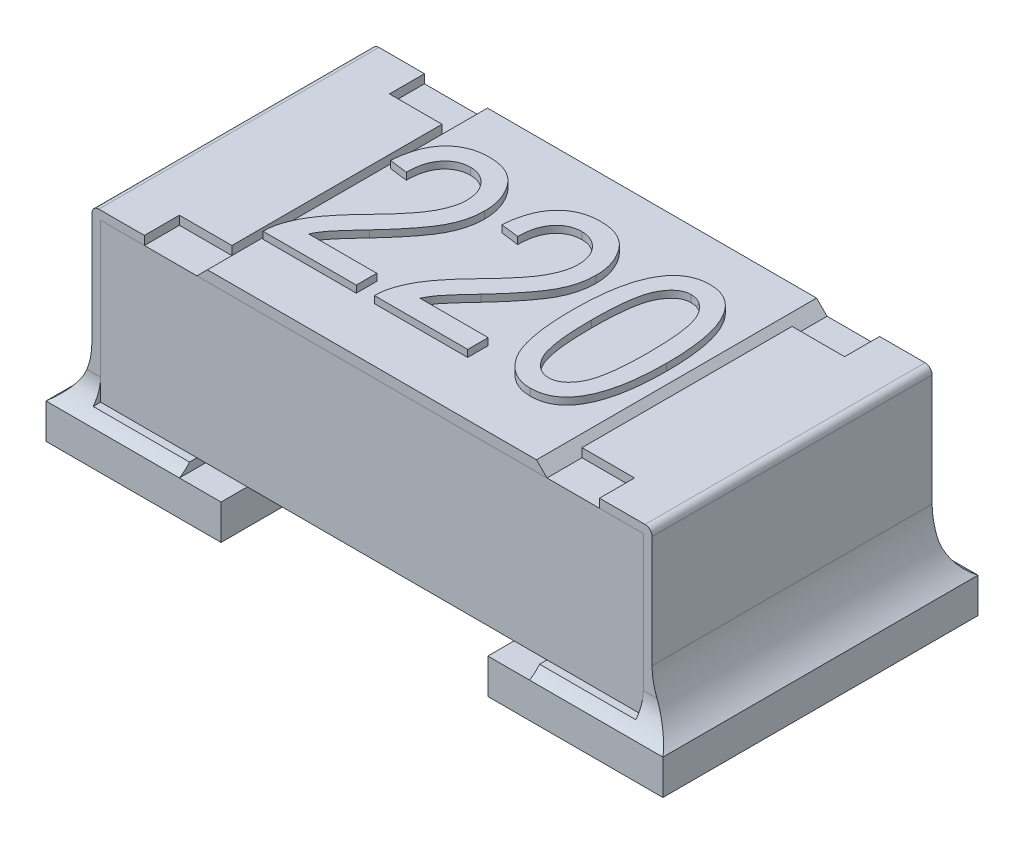
from build123d import *

# Parameters (mm, degrees)
SKETCH1_W             = 0.8
SKETCH1_H             = 0.45
BOSS_EXTRUDE1_DEPTH   = 0.775
BOSS_EXTRUDE2_DEPTH   = 0.4
BOSS_EXTRUDE2_2_DEPTH = 0.4
SKETCH3_W             = 0.15
SKETCH3_H             = 0.1
CUT_EXTRUDE1_DEPTH    = 0.025
BOSS_EXTRUDE3_DEPTH   = 0.4
SKETCH7_W             = 0.5
SKETCH7_H             = 0.9
BOSS_EXTRUDE5_DEPTH   = 0.1
FILLET3_R             = 0.2
FILLET4_R             = 0.2
FILLET5_R             = 0.1
FILLET6_R             = 0.1
BOSS_EXTRU_1_DEPTH    = 0.02


with BuildPart() as part:
    # Sketch1 → Boss-Extrude1 (new, symmetric)
    with BuildSketch(Plane(origin=(0, 0, 0), x_dir=(0, 0, -1), z_dir=(1, 0, 0))):
        with Locations((0, 0.35)):
            Rectangle(SKETCH1_W, SKETCH1_H)
    extrude(amount=BOSS_EXTRUDE1_DEPTH, both=True)


with BuildPart() as body_2:
    # Sketch2 → Boss-Extrude2 (new, symmetric)
    with BuildSketch(Plane.XY):
        with BuildLine():
            Line((-0.5, 0.6), (-0.78, 0.6))
            ThreePointArc((-0.78, 0.6), (-0.794142136, 0.594142136), (-0.8, 0.58))
            Line((-0.8, 0.58), (-0.8, 0.1))
            Line((-0.8, 0.1), (-0.5, 0.1))
            Line((-0.5, 0.1), (-0.5, 0.125))
            Line((-0.5, 0.125), (-0.775, 0.125))
            Line((-0.775, 0.125), (-0.775, 0.575))
            Line((-0.775, 0.575), (-0.5, 0.575))
            Line((-0.5, 0.575), (-0.5, 0.6))
        make_face()
    extrude(amount=BOSS_EXTRUDE2_DEPTH, both=True)


with BuildPart() as body_3:
    # Sketch2 → Boss-Extrude2 2 (new, symmetric)
    with BuildSketch(Plane.XY):
        with BuildLine():
            Line((0.5, 0.575), (0.5, 0.6))
            Line((0.5, 0.6), (0.78, 0.6))
            ThreePointArc((0.78, 0.6), (0.794142136, 0.594142136), (0.8, 0.58))
            Line((0.8, 0.58), (0.8, 0.1))
            Line((0.8, 0.1), (0.5, 0.1))
            Line((0.5, 0.1), (0.5, 0.125))
            Line((0.5, 0.125), (0.775, 0.125))
            Line((0.775, 0.125), (0.775, 0.575))
            Line((0.775, 0.575), (0.5, 0.575))
        make_face()
    extrude(amount=BOSS_EXTRUDE2_2_DEPTH, both=True)


with BuildPart() as cut_extrude1_tool:
    # Sketch3 → Cut-Extrude1 (new body)
    with BuildSketch(Plane(origin=(0, 0.6, 0), x_dir=(1, 0, 0), z_dir=(0, 1, 0))):
        with Locations((-0.575, 0.35)):
            Rectangle(SKETCH3_W, SKETCH3_H)
        with Locations((-0.575, -0.35)):
            Rectangle(SKETCH3_W, SKETCH3_H)
        with Locations((0.575, -0.35)):
            Rectangle(SKETCH3_W, SKETCH3_H)
        with Locations((0.575, 0.35)):
            Rectangle(SKETCH3_W, SKETCH3_H)
    extrude(amount=-CUT_EXTRUDE1_DEPTH)


with BuildPart() as body_2_1:
    add(body_2.part)

    # Cut-Extrude1: cut by cut_extrude1_tool
    add(cut_extrude1_tool.part, mode=Mode.SUBTRACT)



with BuildPart() as body_3_1:
    add(body_3.part)

    # Cut-Extrude1: cut by cut_extrude1_tool
    add(cut_extrude1_tool.part, mode=Mode.SUBTRACT)


with BuildPart() as body_4:
    # Sketch4 → Boss-Extrude3 (new, symmetric)
    with BuildSketch(Plane.XY):
        Polygon((-0.5, 0.575), (0.5, 0.575), (0.47, 0.605), (-0.47, 0.605), align=None)
    extrude(amount=BOSS_EXTRUDE3_DEPTH, both=True)

    # Esquisse2 → Boss.-Extru.1 (add)
    # profile 1 of 3: a face of its own
    with BuildSketch(Plane(origin=(0, 0.605, 0), x_dir=(1, 0, 0), z_dir=(0, 1, 0))):
        with BuildLine():
            Line((-0.199497081, -0.186780329), (-0.199497081, -0.245221888))
            Line((-0.199497081, -0.245221888), (-0.465730847, -0.245221888))
            add(Edge.make_bspline(
                [(-0.465730847, -0.245221888), (-0.465743174, -0.242176838), (-0.465768148, -0.236007517), (-0.464937832, -0.226601844), (-0.463231876, -0.216968453), (-0.461053544, -0.206978835), (-0.457964907, -0.196764374), (-0.454183842, -0.186275439), (-0.449722518, -0.175538143), (-0.444498715, -0.164488895), (-0.438394438, -0.153021711), (-0.431028345, -0.141184566), (-0.422562877, -0.128765128), (-0.412986839, -0.115839112), (-0.402112947, -0.102529104), (-0.390263949, -0.088637518), (-0.377270744, -0.074193289), (-0.368019554, -0.064593521), (-0.363255198, -0.059649647)],
                knots=[0, 0, 0, 0, 0.672188691, 1.361865275, 2.08134618, 2.831455259, 3.618325166, 4.435686407, 5.292818481, 6.184803937, 7.133719261, 8.159707436, 9.261705982, 10.452168352, 11.710682541, 13.056179633, 14.483934645, 16, 16, 16, 16], degree=3))
            add(Edge.make_bspline(
                [(-0.363255198, -0.059649647), (-0.357718482, -0.053922862), (-0.347057966, -0.042896383), (-0.332054308, -0.026615111), (-0.318421978, -0.011481871), (-0.306433341, 0.002776991), (-0.295875555, 0.015967273), (-0.286642397, 0.028070116), (-0.279175119, 0.039360185), (-0.271112582, 0.052644574), (-0.263426099, 0.068459429), (-0.256630812, 0.086894144), (-0.252240187, 0.104715028), (-0.251704992, 0.116463957), (-0.251445133, 0.122168535)],
                knots=[0, 0, 0, 0, 1.312560889, 2.527233899, 3.64818266, 4.668586789, 5.596397896, 6.432357998, 7.175835261, 7.825761013, 8.992224112, 10.065918602, 11.060925749, 12, 12, 12, 12], degree=3))
            add(Edge.make_bspline(
                [(-0.251445133, 0.122168535), (-0.251481367, 0.125317915), (-0.251552135, 0.131468985), (-0.252754744, 0.140451965), (-0.254469824, 0.14899617), (-0.256734237, 0.157163351), (-0.259944913, 0.164819361), (-0.263791845, 0.172017316), (-0.26829798, 0.178789817), (-0.273440164, 0.185037408), (-0.279110823, 0.190673516), (-0.285086903, 0.195736851), (-0.291523865, 0.199834879), (-0.298157149, 0.203402296), (-0.305210907, 0.205987741), (-0.312536604, 0.207958519), (-0.320202019, 0.209069733), (-0.325406889, 0.209238117), (-0.328048217, 0.209323567)],
                knots=[0, 0, 0, 0, 1.164486654, 2.274364258, 3.346924328, 4.388668322, 5.404300818, 6.412115579, 7.404820287, 8.409522099, 9.400647826, 10.360464378, 11.301161788, 12.219192522, 13.141987859, 14.073903283, 15.022558797, 16, 16, 16, 16], degree=3))
            add(Edge.make_bspline(
                [(-0.328048217, 0.209323567), (-0.330896087, 0.209263822), (-0.336455261, 0.209147197), (-0.344558118, 0.207697867), (-0.352322144, 0.205758951), (-0.35970794, 0.202751859), (-0.366661483, 0.198899959), (-0.373282941, 0.194263463), (-0.379442709, 0.188754733), (-0.385264869, 0.182490648), (-0.390368734, 0.175347606), (-0.395054831, 0.167618053), (-0.398744935, 0.158974566), (-0.401882588, 0.149683668), (-0.404339864, 0.139637057), (-0.405982357, 0.128872622), (-0.407186878, 0.117392989), (-0.407254524, 0.109489326), (-0.407289289, 0.105427463)],
                knots=[0, 0, 0, 0, 0.928788257, 1.813037313, 2.680996359, 3.53827917, 4.408273621, 5.272359245, 6.172129225, 7.102295458, 8.058839945, 9.034325244, 10.048074492, 11.120300332, 12.234644845, 13.420320921, 14.674247329, 16, 16, 16, 16], degree=3))
            Line((-0.407289289, 0.105427463), (-0.459237341, 0.11192097))
            add(Edge.make_bspline(
                [(-0.459237341, 0.11192097), (-0.458701991, 0.117949128), (-0.457663387, 0.129644029), (-0.454938381, 0.146574214), (-0.451156945, 0.162282392), (-0.446668145, 0.176925272), (-0.441020716, 0.190321129), (-0.434706712, 0.202713751), (-0.427223104, 0.213833745), (-0.418877647, 0.223818585), (-0.409740231, 0.232677174), (-0.399862354, 0.24032371), (-0.389257431, 0.246769595), (-0.37804657, 0.252189545), (-0.365998038, 0.256236922), (-0.353327986, 0.259174418), (-0.339933362, 0.260914731), (-0.33079277, 0.261150899), (-0.326120457, 0.261271619)],
                knots=[0, 0, 0, 0, 1.296155121, 2.514599762, 3.669097984, 4.755193195, 5.79120272, 6.77953026, 7.729955905, 8.65570694, 9.562583864, 10.450894749, 11.325630111, 12.216772649, 13.112585423, 14.04224033, 14.999270054, 16, 16, 16, 16], degree=3))
            add(Edge.make_bspline(
                [(-0.326120457, 0.261271619), (-0.321075712, 0.261123536), (-0.311252755, 0.260835194), (-0.296952845, 0.258935248), (-0.283615565, 0.255583871), (-0.271181342, 0.250920378), (-0.259799508, 0.244781019), (-0.249284926, 0.237416689), (-0.239813072, 0.228603521), (-0.231383987, 0.21857538), (-0.223934796, 0.207748797), (-0.217434889, 0.196427916), (-0.211796742, 0.18480032), (-0.207390371, 0.172736626), (-0.203710582, 0.16039874), (-0.201398858, 0.147599635), (-0.199771421, 0.134486989), (-0.199589044, 0.125623379), (-0.199497081, 0.121153924)],
                knots=[0, 0, 0, 0, 1.141256367, 2.222215694, 3.255808886, 4.246221905, 5.218350639, 6.173592628, 7.142736081, 8.136099926, 9.131465336, 10.11177911, 11.087094076, 12.050634184, 13.014356534, 13.995714735, 14.989343724, 16, 16, 16, 16], degree=3))
            add(Edge.make_bspline(
                [(-0.199497081, 0.121153924), (-0.199583728, 0.117127141), (-0.199755892, 0.109126037), (-0.200875836, 0.097187936), (-0.202852746, 0.085410333), (-0.205419676, 0.073679984), (-0.209062168, 0.062178516), (-0.213185662, 0.050723257), (-0.218187141, 0.039443439), (-0.224091512, 0.028118881), (-0.231004762, 0.016348836), (-0.239289123, 0.003918486), (-0.24879096, -0.009504436), (-0.259896223, -0.023680764), (-0.272066807, -0.039018169), (-0.285840388, -0.055130192), (-0.300948235, -0.072158915), (-0.311592152, -0.083713449), (-0.317090425, -0.089682115)],
                knots=[0, 0, 0, 0, 0.78053567, 1.550902233, 2.321464013, 3.094364546, 3.87611052, 4.657966429, 5.453363508, 6.265521698, 7.132350641, 8.097801917, 9.160103787, 10.319208993, 11.587678713, 12.955014444, 14.427067756, 16, 16, 16, 16], degree=3))
            add(Edge.make_bspline(
                [(-0.317090425, -0.089682115), (-0.320580917, -0.093395828), (-0.327251526, -0.100493032), (-0.336697909, -0.110762774), (-0.34517471, -0.120105032), (-0.352866486, -0.128388282), (-0.359392972, -0.135891091), (-0.365051358, -0.142415262), (-0.369674693, -0.148041211), (-0.376603621, -0.156885556), (-0.385342795, -0.169347157), (-0.391380498, -0.181095194), (-0.394302276, -0.186780329)],
                knots=[0, 0, 0, 0, 1.227496676, 2.345844757, 3.360613726, 4.265798447, 5.068085109, 5.75545707, 6.345771879, 6.821573405, 8.46188917, 10, 10, 10, 10], degree=3))
            Line((-0.394302276, -0.186780329), (-0.199497081, -0.186780329))
        make_face()
    # profile 2 of 3: a face of its own
    with BuildSketch(Plane(origin=(0, 0.605, 0), x_dir=(1, 0, 0), z_dir=(0, 1, 0))):
        with BuildLine():
            Line((0.118684737, -0.186780329), (0.118684737, -0.245221888))
            Line((0.118684737, -0.245221888), (-0.147549029, -0.245221888))
            add(Edge.make_bspline(
                [(-0.147549029, -0.245221888), (-0.147561356, -0.242176838), (-0.14758633, -0.236007517), (-0.146756014, -0.226601844), (-0.145050058, -0.216968453), (-0.142871726, -0.206978835), (-0.139783089, -0.196764374), (-0.136002024, -0.186275439), (-0.1315407, -0.175538143), (-0.126316897, -0.164488895), (-0.12021262, -0.153021711), (-0.112846526, -0.141184566), (-0.104381059, -0.128765128), (-0.094805021, -0.115839112), (-0.083931129, -0.102529104), (-0.072082131, -0.088637518), (-0.059088925, -0.074193289), (-0.049837736, -0.064593521), (-0.04507338, -0.059649647)],
                knots=[0, 0, 0, 0, 0.672188691, 1.361865275, 2.08134618, 2.831455259, 3.618325166, 4.435686407, 5.292818481, 6.184803937, 7.133719261, 8.159707436, 9.261705982, 10.452168352, 11.710682541, 13.056179633, 14.483934645, 16, 16, 16, 16], degree=3))
            add(Edge.make_bspline(
                [(-0.04507338, -0.059649647), (-0.039536664, -0.053922862), (-0.028876148, -0.042896383), (-0.01387249, -0.026615111), (-0.00024016, -0.011481871), (0.011748477, 0.002776991), (0.022306263, 0.015967273), (0.031539421, 0.028070116), (0.039006699, 0.039360185), (0.047069236, 0.052644574), (0.054755719, 0.068459429), (0.061551006, 0.086894144), (0.065941631, 0.104715028), (0.066476827, 0.116463957), (0.066736685, 0.122168535)],
                knots=[0, 0, 0, 0, 1.312560889, 2.527233899, 3.64818266, 4.668586789, 5.596397896, 6.432357998, 7.175835261, 7.825761013, 8.992224112, 10.065918602, 11.060925749, 12, 12, 12, 12], degree=3))
            add(Edge.make_bspline(
                [(0.066736685, 0.122168535), (0.066700452, 0.125317915), (0.066629683, 0.131468985), (0.065427074, 0.140451965), (0.063711995, 0.14899617), (0.061447582, 0.157163351), (0.058236905, 0.164819361), (0.054389973, 0.172017316), (0.049883838, 0.178789817), (0.044741654, 0.185037408), (0.039070995, 0.190673516), (0.033094916, 0.195736851), (0.026657954, 0.199834879), (0.020024669, 0.203402296), (0.012970912, 0.205987741), (0.005645214, 0.207958519), (-0.002020201, 0.209069733), (-0.00722507, 0.209238117), (-0.009866399, 0.209323567)],
                knots=[0, 0, 0, 0, 1.164486654, 2.274364258, 3.346924328, 4.388668322, 5.404300818, 6.412115579, 7.404820287, 8.409522099, 9.400647826, 10.360464378, 11.301161788, 12.219192522, 13.141987859, 14.073903283, 15.022558797, 16, 16, 16, 16], degree=3))
            add(Edge.make_bspline(
                [(-0.009866399, 0.209323567), (-0.012714269, 0.209263822), (-0.018273442, 0.209147197), (-0.0263763, 0.207697867), (-0.034140326, 0.205758951), (-0.041526122, 0.202751859), (-0.048479664, 0.198899959), (-0.055101123, 0.194263463), (-0.06126089, 0.188754733), (-0.067083051, 0.182490648), (-0.072186916, 0.175347606), (-0.076873013, 0.167618053), (-0.080563117, 0.158974566), (-0.08370077, 0.149683668), (-0.086158046, 0.139637057), (-0.087800539, 0.128872622), (-0.08900506, 0.117392989), (-0.089072706, 0.109489326), (-0.08910747, 0.105427463)],
                knots=[0, 0, 0, 0, 0.928788257, 1.813037313, 2.680996359, 3.53827917, 4.408273621, 5.272359245, 6.172129225, 7.102295458, 8.058839945, 9.034325244, 10.048074492, 11.120300332, 12.234644845, 13.420320921, 14.674247329, 16, 16, 16, 16], degree=3))
            Line((-0.08910747, 0.105427463), (-0.141055522, 0.11192097))
            add(Edge.make_bspline(
                [(-0.141055522, 0.11192097), (-0.140520172, 0.117949128), (-0.139481569, 0.129644029), (-0.136756563, 0.146574214), (-0.132975127, 0.162282392), (-0.128486326, 0.176925272), (-0.122838898, 0.190321129), (-0.116524893, 0.202713751), (-0.109041286, 0.213833745), (-0.100695829, 0.223818585), (-0.091558412, 0.232677174), (-0.081680536, 0.24032371), (-0.071075613, 0.246769595), (-0.059864752, 0.252189545), (-0.04781622, 0.256236922), (-0.035146168, 0.259174418), (-0.021751544, 0.260914731), (-0.012610952, 0.261150899), (-0.007938639, 0.261271619)],
                knots=[0, 0, 0, 0, 1.296155121, 2.514599762, 3.669097984, 4.755193195, 5.79120272, 6.77953026, 7.729955905, 8.65570694, 9.562583864, 10.450894749, 11.325630111, 12.216772649, 13.112585423, 14.04224033, 14.999270054, 16, 16, 16, 16], degree=3))
            add(Edge.make_bspline(
                [(-0.007938639, 0.261271619), (-0.002893894, 0.261123536), (0.006929063, 0.260835194), (0.021228973, 0.258935248), (0.034566253, 0.255583871), (0.047000476, 0.250920378), (0.05838231, 0.244781019), (0.068896892, 0.237416689), (0.078368746, 0.228603521), (0.086797831, 0.21857538), (0.094247023, 0.207748797), (0.100746929, 0.196427916), (0.106385076, 0.18480032), (0.110791448, 0.172736626), (0.114471237, 0.16039874), (0.116782961, 0.147599635), (0.118410397, 0.134486989), (0.118592774, 0.125623379), (0.118684737, 0.121153924)],
                knots=[0, 0, 0, 0, 1.141256367, 2.222215694, 3.255808886, 4.246221905, 5.218350639, 6.173592628, 7.142736081, 8.136099926, 9.131465336, 10.11177911, 11.087094076, 12.050634184, 13.014356534, 13.995714735, 14.989343724, 16, 16, 16, 16], degree=3))
            add(Edge.make_bspline(
                [(0.118684737, 0.121153924), (0.118598091, 0.117127141), (0.118425926, 0.109126037), (0.117305982, 0.097187936), (0.115329072, 0.085410333), (0.112762142, 0.073679984), (0.109119651, 0.062178516), (0.104996156, 0.050723257), (0.099994677, 0.039443439), (0.094090307, 0.028118881), (0.087177056, 0.016348836), (0.078892695, 0.003918486), (0.069390858, -0.009504436), (0.058285595, -0.023680764), (0.046115011, -0.039018169), (0.03234143, -0.055130192), (0.017233584, -0.072158915), (0.006589666, -0.083713449), (0.001091393, -0.089682115)],
                knots=[0, 0, 0, 0, 0.78053567, 1.550902233, 2.321464013, 3.094364546, 3.87611052, 4.657966429, 5.453363508, 6.265521698, 7.132350641, 8.097801917, 9.160103787, 10.319208993, 11.587678713, 12.955014444, 14.427067756, 16, 16, 16, 16], degree=3))
            add(Edge.make_bspline(
                [(0.001091393, -0.089682115), (-0.002399098, -0.093395828), (-0.009069708, -0.100493032), (-0.018516091, -0.110762774), (-0.026992892, -0.120105032), (-0.034684668, -0.128388282), (-0.041211154, -0.135891091), (-0.04686954, -0.142415262), (-0.051492875, -0.148041211), (-0.058421803, -0.156885556), (-0.067160977, -0.169347157), (-0.07319868, -0.181095194), (-0.076120457, -0.186780329)],
                knots=[0, 0, 0, 0, 1.227496676, 2.345844757, 3.360613726, 4.265798447, 5.068085109, 5.75545707, 6.345771879, 6.821573405, 8.46188917, 10, 10, 10, 10], degree=3))
            Line((-0.076120457, -0.186780329), (0.118684737, -0.186780329))
        make_face()
    # profile 3 of 3: a face of its own
    with BuildSketch(Plane(origin=(0, 0.605, 0), x_dir=(1, 0, 0), z_dir=(0, 1, 0))):
        with BuildLine():
            add(Edge.make_bspline(
                [(0.170632789, 0.00457519), (0.170715281, 0.01479126), (0.17087546, 0.034628409), (0.172530877, 0.063399949), (0.17514196, 0.090278959), (0.178692681, 0.115229398), (0.183498163, 0.138255011), (0.189157098, 0.15939274), (0.196107399, 0.178575365), (0.203930391, 0.195885139), (0.212901565, 0.21122541), (0.222791904, 0.224648892), (0.233894793, 0.235937722), (0.245904083, 0.245324824), (0.259058682, 0.252476152), (0.273171359, 0.257615666), (0.288294284, 0.260717058), (0.298729631, 0.261084261), (0.304054056, 0.261271619)],
                knots=[0, 0, 0, 0, 1.522295809, 2.955932353, 4.292935845, 5.545987552, 6.709403679, 7.796379217, 8.803980711, 9.746667296, 10.623167879, 11.447716403, 12.224665142, 12.975696349, 13.710987297, 14.4460191, 15.207112772, 16, 16, 16, 16], degree=3))
            add(Edge.make_bspline(
                [(0.304054056, 0.261271619), (0.308798968, 0.261119405), (0.31811689, 0.260820492), (0.331714096, 0.258355488), (0.344503146, 0.254161939), (0.356493701, 0.248334155), (0.367649338, 0.240809961), (0.378079815, 0.231712272), (0.38767083, 0.22085766), (0.393224555, 0.212703293), (0.396079218, 0.208511879)],
                knots=[0, 0, 0, 0, 1.02435884, 2.0116063, 2.972586715, 3.92329494, 4.881606269, 5.870473939, 6.905405214, 8, 8, 8, 8], degree=3))
            add(Edge.make_bspline(
                [(0.396079218, 0.208511879), (0.399383571, 0.202860902), (0.406255323, 0.191109101), (0.414460529, 0.171419216), (0.42137676, 0.149427268), (0.427208245, 0.125063264), (0.431367976, 0.098276968), (0.434660149, 0.069172575), (0.436565497, 0.037676929), (0.436763796, 0.015873733), (0.436866556, 0.00457519)],
                knots=[0, 0, 0, 0, 0.745747152, 1.550859881, 2.42529298, 3.372802996, 4.404287875, 5.514077945, 6.711780846, 8, 8, 8, 8], degree=3))
            add(Edge.make_bspline(
                [(0.436866556, 0.00457519), (0.436785064, -0.005573368), (0.436626857, -0.025275587), (0.434954873, -0.053910105), (0.432378579, -0.080658499), (0.428779632, -0.10553284), (0.424018716, -0.128501924), (0.41828459, -0.149633905), (0.411551199, -0.168919426), (0.403619919, -0.186231046), (0.394780809, -0.201660817), (0.384722691, -0.214948272), (0.373887382, -0.226438872), (0.361722207, -0.23562265), (0.348657364, -0.242976397), (0.334449575, -0.248029288), (0.319276239, -0.251174149), (0.308804717, -0.25153216), (0.303445289, -0.251715394)],
                knots=[0, 0, 0, 0, 1.513874866, 2.939007974, 4.277477108, 5.521918538, 6.686610019, 7.774777114, 8.786532326, 9.730252297, 10.61206932, 11.433487149, 12.211385775, 12.960169701, 13.698700869, 14.439280195, 15.201208188, 16, 16, 16, 16], degree=3))
            add(Edge.make_bspline(
                [(0.303445289, -0.251715394), (0.298665094, -0.251535975), (0.289266692, -0.251183218), (0.275476763, -0.248501144), (0.262425349, -0.243876751), (0.250043505, -0.237523555), (0.238314772, -0.229401051), (0.227382453, -0.219338145), (0.216982421, -0.207599728), (0.207239757, -0.19396939), (0.198435777, -0.178096762), (0.190993587, -0.159604049), (0.184653069, -0.138579583), (0.179621562, -0.114938484), (0.175386544, -0.08877738), (0.172724999, -0.059965056), (0.170960895, -0.028557109), (0.170745014, -0.006757381), (0.170632789, 0.00457519)],
                knots=[0, 0, 0, 0, 0.713782411, 1.403376538, 2.088831486, 2.775699897, 3.476400496, 4.213162367, 4.989742879, 5.815463779, 6.710980744, 7.6941898, 8.787315853, 9.987366569, 11.302150399, 12.743876293, 14.307306722, 16, 16, 16, 16], degree=3))
        make_face()
        with BuildLine():
            add(Edge.make_bspline(
                [(0.222580841, 0.004778112), (0.222671423, -0.004962844), (0.22284446, -0.023570963), (0.223795402, -0.050273881), (0.225592775, -0.074440086), (0.228089142, -0.096145725), (0.231254125, -0.115301137), (0.235160442, -0.132011786), (0.239815203, -0.146209724), (0.245291529, -0.158097103), (0.251364396, -0.167965156), (0.257851, -0.176373903), (0.264557947, -0.183666527), (0.271889552, -0.189491854), (0.279501136, -0.194202042), (0.287686824, -0.19727545), (0.296157875, -0.199493814), (0.302010065, -0.199675523), (0.304967205, -0.199767342)],
                knots=[0, 0, 0, 0, 1.930873368, 3.688541263, 5.295281011, 6.732986767, 8.018032389, 9.141589856, 10.131594649, 10.974379403, 11.729767228, 12.422984227, 13.077418253, 13.687793181, 14.274134012, 14.843047171, 15.415386244, 16, 16, 16, 16], degree=3))
            add(Edge.make_bspline(
                [(0.304967205, -0.199767342), (0.307754755, -0.19967107), (0.31330521, -0.199479377), (0.321396024, -0.197283662), (0.329195942, -0.194062792), (0.336573874, -0.189401372), (0.343519227, -0.183405877), (0.350126132, -0.176126804), (0.356404425, -0.167556151), (0.362424933, -0.157540122), (0.367843075, -0.145592351), (0.37245162, -0.131326946), (0.376329459, -0.114621658), (0.379537126, -0.095476215), (0.381860981, -0.073856395), (0.383721462, -0.049836144), (0.384647715, -0.023333722), (0.384825652, -0.004861208), (0.384918504, 0.004778112)],
                knots=[0, 0, 0, 0, 0.556098029, 1.107279675, 1.665020537, 2.239289732, 2.843790749, 3.494855459, 4.20099618, 4.965402842, 5.827994078, 6.818278647, 7.958442113, 9.254955883, 10.697998423, 12.305588537, 14.072183745, 16, 16, 16, 16], degree=3))
            add(Edge.make_bspline(
                [(0.384918504, 0.004778112), (0.384826066, 0.014518953), (0.38464884, 0.033194439), (0.383718362, 0.059932684), (0.381888376, 0.084163121), (0.379436176, 0.105841815), (0.376210526, 0.125018143), (0.372381575, 0.141717126), (0.367650706, 0.155886496), (0.362252151, 0.167750164), (0.35605568, 0.177530431), (0.349728957, 0.186066808), (0.342795784, 0.193179002), (0.335508271, 0.199101273), (0.327760282, 0.203716122), (0.319517818, 0.207013805), (0.310844963, 0.208998194), (0.304909726, 0.209214654), (0.301923374, 0.209323567)],
                knots=[0, 0, 0, 0, 1.926173374, 3.692928135, 5.28908838, 6.72993665, 8.005261178, 9.132588719, 10.113846285, 10.954579593, 11.702439438, 12.399284011, 13.051919516, 13.660808713, 14.251466784, 14.827675714, 15.41013748, 16, 16, 16, 16], degree=3))
            add(Edge.make_bspline(
                [(0.301923374, 0.209323567), (0.29913537, 0.209229838), (0.29361687, 0.209044314), (0.285593326, 0.206839344), (0.277895922, 0.203615308), (0.270572037, 0.198933153), (0.263714085, 0.192853165), (0.257053603, 0.185619176), (0.250913, 0.176971227), (0.244870415, 0.16704689), (0.239547287, 0.155067165), (0.234931593, 0.140826575), (0.231219243, 0.124091318), (0.227938784, 0.105003485), (0.225644625, 0.083411294), (0.22377595, 0.059392779), (0.222852186, 0.03288983), (0.222673883, 0.014417392), (0.222580841, 0.004778112)],
                knots=[0, 0, 0, 0, 0.557102101, 1.102712893, 1.655222221, 2.224793741, 2.834805151, 3.487045402, 4.190458401, 4.956245252, 5.811421647, 6.809929224, 7.950602775, 9.242777249, 10.688425301, 12.298918027, 14.068702942, 16, 16, 16, 16], degree=3))
        make_face(mode=Mode.SUBTRACT)
    extrude(amount=BOSS_EXTRU_1_DEPTH)


with BuildPart() as body_2_2:
    add(body_2_1.part)

    add(body_3_1.part)  # Boss-Extrude5 merges body 3
    # Sketch7 → Boss-Extrude5 (add)
    with BuildSketch(Plane(origin=(0, 0, 0), x_dir=(1, 0, 0), z_dir=(0, 1, 0))):
        with Locations((-0.631, 0)):
            Rectangle(SKETCH7_W, SKETCH7_H)
        with Locations((0.631, 0)):
            Rectangle(SKETCH7_W, SKETCH7_H)
    extrude(amount=BOSS_EXTRUDE5_DEPTH)

    # Fillet3
    # the kernel refuses this fillet: 0.2 mm, written as the material it adds along each edge
    with BuildSketch(Plane(origin=(-0.8, 0.1, -0.4), x_dir=(-1.0, 1.981473969784949e-11, 0), z_dir=(0, 0, 1))) as fillet3_piece_1:
        with BuildLine():
            CenterArc((0.2, -0.16074514), FILLET3_R, 126.5126321, 53.487367901)
            Line((0, -0.16074514), (-0.004, -0.16074514))
            Line((-0.004, -0.16074514), (-0.004, 0))
            Line((-0.004, 0), (0, 0.004))
            ThreePointArc((0, 0.004), (0.0405, 0.004), (0.07862, 0.003214903))
            Line((0.07862, 0.003214903), (0.081, 0))
        make_face()
    extrude(amount=0.8)

    # Fillet4
    # the kernel refuses this fillet: 0.2 mm, written as the material it adds along each edge
    with BuildSketch(Plane(origin=(0.8, 0.1, 0.4), x_dir=(1.0, 1.981542502070424e-11, 0), z_dir=(0, 0, -1))) as fillet4_piece_1:
        with BuildLine():
            CenterArc((0.2, -0.16074514), FILLET4_R, 126.5126321, 53.487367901)
            Line((0, -0.16074514), (-0.004, -0.16074514))
            Line((-0.004, -0.16074514), (-0.004, 0))
            Line((-0.004, 0), (0, 0.004))
            ThreePointArc((0, 0.004), (0.0405, 0.004), (0.07862, 0.003214903))
            Line((0.07862, 0.003214903), (0.081, 0))
        make_face()
    extrude(amount=0.8)

    # Fillet5
    # the kernel refuses this fillet: 0.1 mm, written as the material it adds along each edge
    with BuildSketch(Plane(origin=(0.5, 0.1, 0.4), x_dir=(0, -1.6392998070069752e-11, 1.0), z_dir=(1.0, 4.321346430286522e-12, 0))) as fillet5_piece_1_section:
        with BuildLine():
            CenterArc((0.1, -0.08660254), FILLET5_R, 119.999999999, 60)
            Line((0, -0.08660254), (-0.002, -0.08660254))
            Line((-0.002, -0.08660254), (-0.002, 0))
            Line((-0.002, 0), (0, 0.002))
            ThreePointArc((0, 0.002), (0.025, 0.002), (0.049, 0.001732051))
            Line((0.049, 0.001732051), (0.05, 0))
        make_face()
    fillet5_piece_1 = extrude(amount=0.381, mode=Mode.PRIVATE)
    fillet5_piece_1 = split(fillet5_piece_1, bisect_by=Plane(origin=(0.5, 0.125, 0.4), z_dir=(0, -1, 0)), keep=Keep.TOP, mode=Mode.PRIVATE)
    fillet5_piece_1 = split(fillet5_piece_1, bisect_by=Plane(origin=(0.775, 0.1, 0.4), z_dir=(-1, 0, 0)), keep=Keep.TOP, mode=Mode.PRIVATE)
    add(fillet5_piece_1)
    with BuildSketch(Plane(origin=(0.5, 0.1, 0.4), x_dir=(0, -1.6392998070069752e-11, 1.0), z_dir=(1.0, 4.321346430286522e-12, 0))) as fillet5_piece_2_section:
        with BuildLine():
            CenterArc((0.1, -0.08660254), FILLET5_R, 119.999999999, 60)
            Line((0, -0.08660254), (-0.002, -0.08660254))
            Line((-0.002, -0.08660254), (-0.002, 0))
            Line((-0.002, 0), (0, 0.002))
            ThreePointArc((0, 0.002), (0.025, 0.002), (0.049, 0.001732051))
            Line((0.049, 0.001732051), (0.05, 0))
        make_face()
    fillet5_piece_2 = extrude(amount=0.381, mode=Mode.PRIVATE)
    fillet5_piece_2 = fillet5_piece_2 - Plane(origin=(1, 0.26074514, 0.4), x_dir=(1.0, 2e-11, 0), z_dir=(0, 0, 1)) * Cylinder(0.2, 2, mode=Mode.PRIVATE)
    fillet5_piece_2 = split(fillet5_piece_2, bisect_by=Plane(origin=(0.5, 0.125, 0.4), z_dir=(0, -1, 0)), keep=Keep.TOP, mode=Mode.PRIVATE)
    fillet5_piece_2 = split(fillet5_piece_2, bisect_by=Plane(origin=(0.775, 0.1, 0.4), z_dir=(1, 0, 0)), keep=Keep.TOP, mode=Mode.PRIVATE)
    add(fillet5_piece_2)
    with BuildSketch(Plane(origin=(0.5, 0.1, 0.4), x_dir=(0, -1.6392998070069752e-11, 1.0), z_dir=(1.0, 4.321346430286522e-12, 0))) as fillet5_piece_3_section:
        with BuildLine():
            CenterArc((0.1, -0.08660254), FILLET5_R, 119.999999999, 60)
            Line((0, -0.08660254), (-0.002, -0.08660254))
            Line((-0.002, -0.08660254), (-0.002, 0))
            Line((-0.002, 0), (0, 0.002))
            ThreePointArc((0, 0.002), (0.025, 0.002), (0.049, 0.001732051))
            Line((0.049, 0.001732051), (0.05, 0))
        make_face()
    fillet5_piece_3 = extrude(amount=0.381, mode=Mode.PRIVATE)
    fillet5_piece_3 = fillet5_piece_3 - Plane(origin=(1, 0.26074514, 0.4), x_dir=(1.0, 2e-11, 0), z_dir=(0, 0, 1)) * Cylinder(0.2, 2, mode=Mode.PRIVATE)
    fillet5_piece_3 = split(fillet5_piece_3, bisect_by=Plane(origin=(0.5, 0.125, 0.4), z_dir=(0, 1, 0)), keep=Keep.TOP, mode=Mode.PRIVATE)
    fillet5_piece_3 = split(fillet5_piece_3, bisect_by=Plane(origin=(0.775, 0.1, 0.4), z_dir=(1, 0, 0)), keep=Keep.TOP, mode=Mode.PRIVATE)
    add(fillet5_piece_3)
    # the kernel refuses this fillet: 0.1 mm, written as the material it adds along each edge
    with BuildSketch(Plane(origin=(0.881, 0.1, -0.4), x_dir=(0, -1.639244295855736e-11, -1.0), z_dir=(-1.0, -4.321346430286522e-12, 0))) as fillet5_2_piece_1_section:
        with BuildLine():
            CenterArc((0.1, -0.08660254), FILLET5_R, 119.999999999, 60)
            Line((0, -0.08660254), (-0.002, -0.08660254))
            Line((-0.002, -0.08660254), (-0.002, 0))
            Line((-0.002, 0), (0, 0.002))
            ThreePointArc((0, 0.002), (0.025, 0.002), (0.049, 0.001732051))
            Line((0.049, 0.001732051), (0.05, 0))
        make_face()
    fillet5_2_piece_1 = extrude(amount=0.381, mode=Mode.PRIVATE)
    fillet5_2_piece_1 = fillet5_2_piece_1 - Plane(origin=(1, 0.26074514, -0.4), x_dir=(1.0, 2e-11, 0), z_dir=(0, 0, 1)) * Cylinder(0.2, 2, mode=Mode.PRIVATE)
    fillet5_2_piece_1 = split(fillet5_2_piece_1, bisect_by=Plane(origin=(0.881, 0.125, -0.4), z_dir=(0, -1, 0)), keep=Keep.TOP, mode=Mode.PRIVATE)
    fillet5_2_piece_1 = split(fillet5_2_piece_1, bisect_by=Plane(origin=(0.775, 0.1, -0.4), z_dir=(1, 0, 0)), keep=Keep.TOP, mode=Mode.PRIVATE)
    add(fillet5_2_piece_1)
    with BuildSketch(Plane(origin=(0.881, 0.1, -0.4), x_dir=(0, -1.639244295855736e-11, -1.0), z_dir=(-1.0, -4.321346430286522e-12, 0))) as fillet5_2_piece_2_section:
        with BuildLine():
            CenterArc((0.1, -0.08660254), FILLET5_R, 119.999999999, 60)
            Line((0, -0.08660254), (-0.002, -0.08660254))
            Line((-0.002, -0.08660254), (-0.002, 0))
            Line((-0.002, 0), (0, 0.002))
            ThreePointArc((0, 0.002), (0.025, 0.002), (0.049, 0.001732051))
            Line((0.049, 0.001732051), (0.05, 0))
        make_face()
    fillet5_2_piece_2 = extrude(amount=0.381, mode=Mode.PRIVATE)
    fillet5_2_piece_2 = fillet5_2_piece_2 - Plane(origin=(1, 0.26074514, -0.4), x_dir=(1.0, 2e-11, 0), z_dir=(0, 0, 1)) * Cylinder(0.2, 2, mode=Mode.PRIVATE)
    fillet5_2_piece_2 = split(fillet5_2_piece_2, bisect_by=Plane(origin=(0.881, 0.125, -0.4), z_dir=(0, 1, 0)), keep=Keep.TOP, mode=Mode.PRIVATE)
    fillet5_2_piece_2 = split(fillet5_2_piece_2, bisect_by=Plane(origin=(0.775, 0.1, -0.4), z_dir=(1, 0, 0)), keep=Keep.TOP, mode=Mode.PRIVATE)
    add(fillet5_2_piece_2)
    with BuildSketch(Plane(origin=(0.881, 0.1, -0.4), x_dir=(0, -1.639244295855736e-11, -1.0), z_dir=(-1.0, -4.321346430286522e-12, 0))) as fillet5_2_piece_3_section:
        with BuildLine():
            CenterArc((0.1, -0.08660254), FILLET5_R, 119.999999999, 60)
            Line((0, -0.08660254), (-0.002, -0.08660254))
            Line((-0.002, -0.08660254), (-0.002, 0))
            Line((-0.002, 0), (0, 0.002))
            ThreePointArc((0, 0.002), (0.025, 0.002), (0.049, 0.001732051))
            Line((0.049, 0.001732051), (0.05, 0))
        make_face()
    fillet5_2_piece_3 = extrude(amount=0.381, mode=Mode.PRIVATE)
    fillet5_2_piece_3 = split(fillet5_2_piece_3, bisect_by=Plane(origin=(0.881, 0.125, -0.4), z_dir=(0, -1, 0)), keep=Keep.TOP, mode=Mode.PRIVATE)
    fillet5_2_piece_3 = split(fillet5_2_piece_3, bisect_by=Plane(origin=(0.775, 0.1, -0.4), z_dir=(-1, 0, 0)), keep=Keep.TOP, mode=Mode.PRIVATE)
    add(fillet5_2_piece_3)

    # Fillet6
    # the kernel refuses this fillet: 0.1 mm, written as the material it adds along each edge
    with BuildSketch(Plane(origin=(-0.5, 0.1, -0.4), x_dir=(0, -1.6393275625825854e-11, -1.0), z_dir=(-1.0, 4.321237156366773e-12, 0))) as fillet6_piece_1_section:
        with BuildLine():
            CenterArc((0.1, -0.08660254), FILLET6_R, 119.999999999, 60)
            Line((0, -0.08660254), (-0.002, -0.08660254))
            Line((-0.002, -0.08660254), (-0.002, 0))
            Line((-0.002, 0), (0, 0.002))
            ThreePointArc((0, 0.002), (0.025, 0.002), (0.049, 0.001732051))
            Line((0.049, 0.001732051), (0.05, 0))
        make_face()
    fillet6_piece_1 = extrude(amount=0.381, mode=Mode.PRIVATE)
    fillet6_piece_1 = split(fillet6_piece_1, bisect_by=Plane(origin=(-0.5, 0.125, -0.4), z_dir=(0, -1, 0)), keep=Keep.TOP, mode=Mode.PRIVATE)
    fillet6_piece_1 = split(fillet6_piece_1, bisect_by=Plane(origin=(-0.775, 0.1, -0.4), z_dir=(1, 0, 0)), keep=Keep.TOP, mode=Mode.PRIVATE)
    add(fillet6_piece_1)
    with BuildSketch(Plane(origin=(-0.5, 0.1, -0.4), x_dir=(0, -1.6393275625825854e-11, -1.0), z_dir=(-1.0, 4.321237156366773e-12, 0))) as fillet6_piece_2_section:
        with BuildLine():
            CenterArc((0.1, -0.08660254), FILLET6_R, 119.999999999, 60)
            Line((0, -0.08660254), (-0.002, -0.08660254))
            Line((-0.002, -0.08660254), (-0.002, 0))
            Line((-0.002, 0), (0, 0.002))
            ThreePointArc((0, 0.002), (0.025, 0.002), (0.049, 0.001732051))
            Line((0.049, 0.001732051), (0.05, 0))
        make_face()
    fillet6_piece_2 = extrude(amount=0.381, mode=Mode.PRIVATE)
    fillet6_piece_2 = fillet6_piece_2 - Plane(origin=(-1, 0.26074514, -0.4), x_dir=(-1.0, 2e-11, 0), z_dir=(0, 0, -1)) * Cylinder(0.2, 2, mode=Mode.PRIVATE)
    fillet6_piece_2 = split(fillet6_piece_2, bisect_by=Plane(origin=(-0.5, 0.125, -0.4), z_dir=(0, -1, 0)), keep=Keep.TOP, mode=Mode.PRIVATE)
    fillet6_piece_2 = split(fillet6_piece_2, bisect_by=Plane(origin=(-0.775, 0.1, -0.4), z_dir=(-1, 0, 0)), keep=Keep.TOP, mode=Mode.PRIVATE)
    add(fillet6_piece_2)
    with BuildSketch(Plane(origin=(-0.5, 0.1, -0.4), x_dir=(0, -1.6393275625825854e-11, -1.0), z_dir=(-1.0, 4.321237156366773e-12, 0))) as fillet6_piece_3_section:
        with BuildLine():
            CenterArc((0.1, -0.08660254), FILLET6_R, 119.999999999, 60)
            Line((0, -0.08660254), (-0.002, -0.08660254))
            Line((-0.002, -0.08660254), (-0.002, 0))
            Line((-0.002, 0), (0, 0.002))
            ThreePointArc((0, 0.002), (0.025, 0.002), (0.049, 0.001732051))
            Line((0.049, 0.001732051), (0.05, 0))
        make_face()
    fillet6_piece_3 = extrude(amount=0.381, mode=Mode.PRIVATE)
    fillet6_piece_3 = fillet6_piece_3 - Plane(origin=(-1, 0.26074514, -0.4), x_dir=(-1.0, 2e-11, 0), z_dir=(0, 0, -1)) * Cylinder(0.2, 2, mode=Mode.PRIVATE)
    fillet6_piece_3 = split(fillet6_piece_3, bisect_by=Plane(origin=(-0.5, 0.125, -0.4), z_dir=(0, 1, 0)), keep=Keep.TOP, mode=Mode.PRIVATE)
    fillet6_piece_3 = split(fillet6_piece_3, bisect_by=Plane(origin=(-0.775, 0.1, -0.4), z_dir=(-1, 0, 0)), keep=Keep.TOP, mode=Mode.PRIVATE)
    add(fillet6_piece_3)
    # the kernel refuses this fillet: 0.1 mm, written as the material it adds along each edge
    with BuildSketch(Plane(origin=(-0.881, 0.1, 0.4), x_dir=(0, -1.6393830737338195e-11, 1.0), z_dir=(1.0, -4.321237156366773e-12, 0))) as fillet6_2_piece_1_section:
        with BuildLine():
            CenterArc((0.1, -0.08660254), FILLET6_R, 119.999999999, 60)
            Line((0, -0.08660254), (-0.002, -0.08660254))
            Line((-0.002, -0.08660254), (-0.002, 0))
            Line((-0.002, 0), (0, 0.002))
            ThreePointArc((0, 0.002), (0.025, 0.002), (0.049, 0.001732051))
            Line((0.049, 0.001732051), (0.05, 0))
        make_face()
    fillet6_2_piece_1 = extrude(amount=0.381, mode=Mode.PRIVATE)
    fillet6_2_piece_1 = fillet6_2_piece_1 - Plane(origin=(-1, 0.26074514, 0.4), x_dir=(-1.0, 2e-11, 0), z_dir=(0, 0, -1)) * Cylinder(0.2, 2, mode=Mode.PRIVATE)
    fillet6_2_piece_1 = split(fillet6_2_piece_1, bisect_by=Plane(origin=(-0.881, 0.125, 0.4), z_dir=(0, -1, 0)), keep=Keep.TOP, mode=Mode.PRIVATE)
    fillet6_2_piece_1 = split(fillet6_2_piece_1, bisect_by=Plane(origin=(-0.775, 0.1, 0.4), z_dir=(-1, 0, 0)), keep=Keep.TOP, mode=Mode.PRIVATE)
    add(fillet6_2_piece_1)
    with BuildSketch(Plane(origin=(-0.881, 0.1, 0.4), x_dir=(0, -1.6393830737338195e-11, 1.0), z_dir=(1.0, -4.321237156366773e-12, 0))) as fillet6_2_piece_2_section:
        with BuildLine():
            CenterArc((0.1, -0.08660254), FILLET6_R, 119.999999999, 60)
            Line((0, -0.08660254), (-0.002, -0.08660254))
            Line((-0.002, -0.08660254), (-0.002, 0))
            Line((-0.002, 0), (0, 0.002))
            ThreePointArc((0, 0.002), (0.025, 0.002), (0.049, 0.001732051))
            Line((0.049, 0.001732051), (0.05, 0))
        make_face()
    fillet6_2_piece_2 = extrude(amount=0.381, mode=Mode.PRIVATE)
    fillet6_2_piece_2 = fillet6_2_piece_2 - Plane(origin=(-1, 0.26074514, 0.4), x_dir=(-1.0, 2e-11, 0), z_dir=(0, 0, -1)) * Cylinder(0.2, 2, mode=Mode.PRIVATE)
    fillet6_2_piece_2 = split(fillet6_2_piece_2, bisect_by=Plane(origin=(-0.881, 0.125, 0.4), z_dir=(0, 1, 0)), keep=Keep.TOP, mode=Mode.PRIVATE)
    fillet6_2_piece_2 = split(fillet6_2_piece_2, bisect_by=Plane(origin=(-0.775, 0.1, 0.4), z_dir=(-1, 0, 0)), keep=Keep.TOP, mode=Mode.PRIVATE)
    add(fillet6_2_piece_2)
    with BuildSketch(Plane(origin=(-0.881, 0.1, 0.4), x_dir=(0, -1.6393830737338195e-11, 1.0), z_dir=(1.0, -4.321237156366773e-12, 0))) as fillet6_2_piece_3_section:
        with BuildLine():
            CenterArc((0.1, -0.08660254), FILLET6_R, 119.999999999, 60)
            Line((0, -0.08660254), (-0.002, -0.08660254))
            Line((-0.002, -0.08660254), (-0.002, 0))
            Line((-0.002, 0), (0, 0.002))
            ThreePointArc((0, 0.002), (0.025, 0.002), (0.049, 0.001732051))
            Line((0.049, 0.001732051), (0.05, 0))
        make_face()
    fillet6_2_piece_3 = extrude(amount=0.381, mode=Mode.PRIVATE)
    fillet6_2_piece_3 = split(fillet6_2_piece_3, bisect_by=Plane(origin=(-0.881, 0.125, 0.4), z_dir=(0, -1, 0)), keep=Keep.TOP, mode=Mode.PRIVATE)
    fillet6_2_piece_3 = split(fillet6_2_piece_3, bisect_by=Plane(origin=(-0.775, 0.1, 0.4), z_dir=(1, 0, 0)), keep=Keep.TOP, mode=Mode.PRIVATE)
    add(fillet6_2_piece_3)


solid = Compound([part.part, body_4.part, body_2_2.part])
